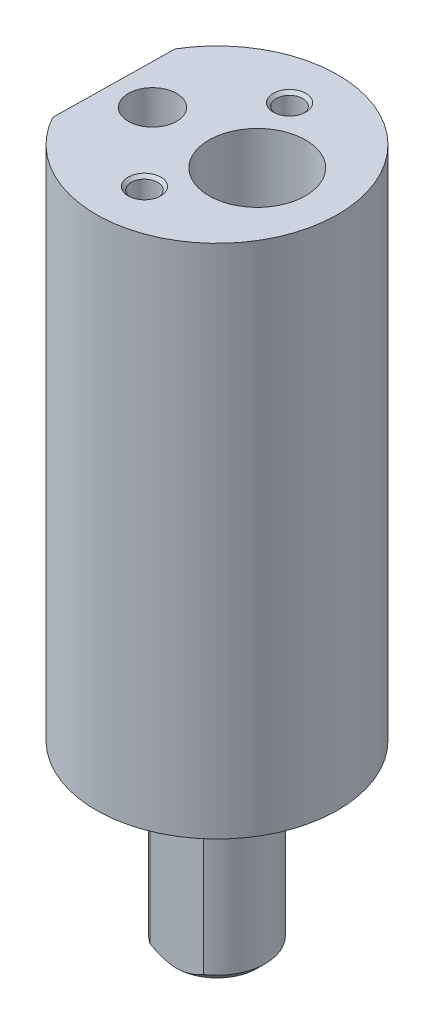
from build123d import *

# Parameters (mm, degrees)
BOSS_EXTRUDE1_DEPTH         = 22
BOSS_EXTRUDE2_DEPTH         = 64
SKETCH3_R                   = 3
CUT_EXTRUDE1_DEPTH          = 65
SKETCH4_R                   = 6
CUT_EXTRUDE2_DEPTH          = 52
M4_TAPPED_HOLE1_D           = 3.3
M4_TAPPED_HOLE1_DEPTH       = 14
M4_TAPPED_HOLE1_CSINK_D     = 4.05
M4_TAPPED_HOLE1_CSINK_ANGLE = 90
M4_TAPPED_HOLE1_TIP         = 0.991420021
SKETCH7_R                   = 1.5
SKETCH7_R_2                 = 2.5
CUT_EXTRUDE3_DEPTH          = 5
SKETCH8_R                   = 1
CUT_EXTRUDE4_DEPTH          = 15
CHAMFER1_SIZE               = 1


with BuildPart() as part:
    # Sketch1 → Boss-Extrude1 (new body)
    with BuildSketch(Plane(origin=(0, 0, 0), x_dir=(1, 0, 0), z_dir=(0, 1, 0))):
        with BuildLine():
            Line((-3.31662479, -5), (3.31662479, -5))
            ThreePointArc((3.31662479, -5), (0, 6), (-3.31662479, -5))
        make_face()
    extrude(amount=BOSS_EXTRUDE1_DEPTH)

    # Sketch2 → Boss-Extrude2 (add)
    with BuildSketch(Plane(origin=(0, 22, 0), x_dir=(1, 0, 0), z_dir=(0, 1, 0))):
        with BuildLine():
            Line((-12.876087246, 7.694568034), (-13.120447109, -7.270066551))
            ThreePointArc((-13.120447109, -7.270066551), (14.99800059, -0.244904702), (-12.876087246, 7.694568034))
        make_face()
    extrude(amount=BOSS_EXTRUDE2_DEPTH)

    # Sketch3 → Cut-Extrude1 (cut)
    with BuildSketch(Plane(origin=(0, 86, 0), x_dir=(1, 0, 0), z_dir=(0, 1, 0))):
        with Locations(Location((-8, 0, 0), (0, 0, 270))):
            Circle(SKETCH3_R)
    extrude(amount=-CUT_EXTRUDE1_DEPTH, mode=Mode.SUBTRACT)

    # Sketch4 → Cut-Extrude2 (cut)
    with BuildSketch(Plane(origin=(0, 86, 0), x_dir=(1, 0, 0), z_dir=(0, 1, 0))):
        with Locations(Location((5, 0, 0), (0, 0, 270))):
            Circle(SKETCH4_R)
    extrude(amount=-CUT_EXTRUDE2_DEPTH, mode=Mode.SUBTRACT)

    # M4 Tapped Hole1
    with Locations(Plane(origin=(0, 86, 0), x_dir=(1, 0, 0), z_dir=(0, 1, 0))):
        with Locations((0, 9), (0, -9)):
            CounterSinkHole(M4_TAPPED_HOLE1_D / 2, M4_TAPPED_HOLE1_CSINK_D / 2, depth=M4_TAPPED_HOLE1_DEPTH, counter_sink_angle=M4_TAPPED_HOLE1_CSINK_ANGLE)
            with Locations((0, 0, -(M4_TAPPED_HOLE1_DEPTH + M4_TAPPED_HOLE1_TIP / 2))):  # 118° drill point
                Cone(0, M4_TAPPED_HOLE1_D / 2, M4_TAPPED_HOLE1_TIP, mode=Mode.SUBTRACT)

    # Sketch7 → Cut-Extrude3 (cut)
    with BuildSketch(Plane(origin=(-12.998267178, 0, -0.212250742), x_dir=(-0.01632698014120525, 0, 0.999866705976086), z_dir=(-0.999866705976086, 0, -0.01632698014120525))):
        with Locations((0, 25)):
            Circle(SKETCH7_R)
        with Locations((0, 54)):
            Circle(SKETCH7_R_2)
    extrude(amount=-CUT_EXTRUDE3_DEPTH, mode=Mode.SUBTRACT)

    # Sketch8 → Cut-Extrude4 (cut)
    with BuildSketch(Plane(origin=(-12.998267178, 0, -0.212250742), x_dir=(-0.01632698014120525, 0, 0.999866705976086), z_dir=(-0.999866705976086, 0, -0.01632698014120525))):
        with Locations((0.020408725, 76)):
            Circle(SKETCH8_R)
        with Locations((0.106125371, 34)):
            Circle(SKETCH8_R)
    extrude(amount=-CUT_EXTRUDE4_DEPTH, mode=Mode.SUBTRACT)

    # Chamfer1
    chamfer1_edges = [part.edges().sort_by_distance(p)[0] for p in [
        (0, 0, -6),
    ]]
    chamfer(chamfer1_edges, length=CHAMFER1_SIZE - 0.0001)  # a hair under: the kernel refuses the full size


solid = part.part
